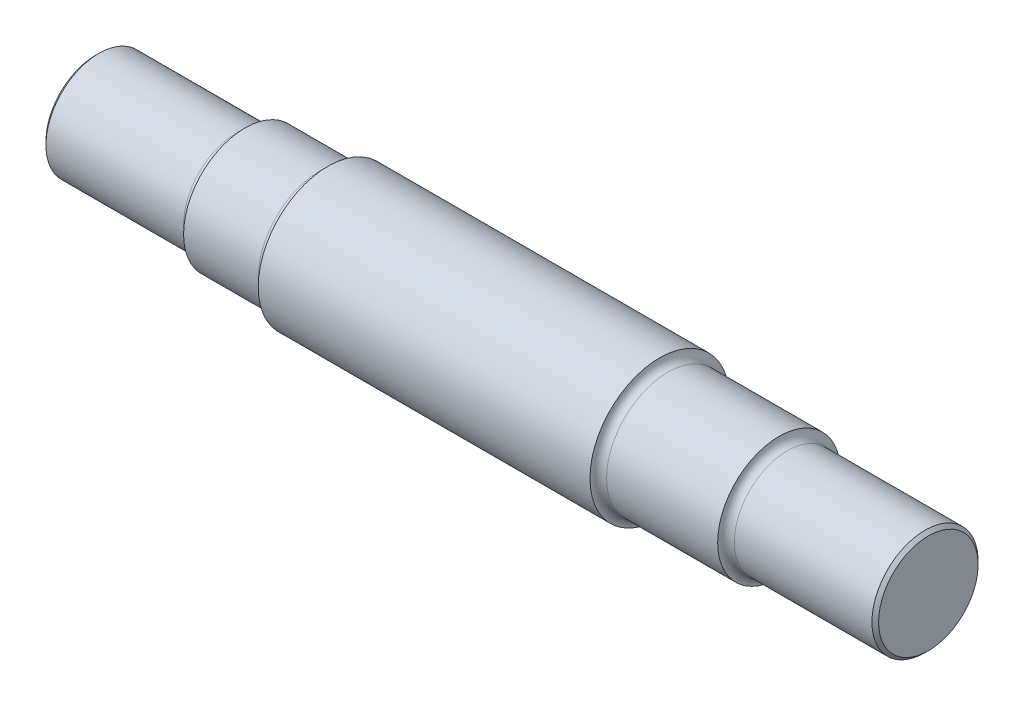
from build123d import *

# Parameters (mm, degrees)
FILLET1_R     = 2.5
CHAMFER1_SIZE = 1


with BuildPart() as part:
    # Sketch1 → Revolve1 (revolve)
    with BuildSketch(Plane.XY, mode=Mode.PRIVATE) as revolve1_sk:
        Polygon((0, 0), (251, 0), (251, 16), (206, 16), (206, 18.5), (170, 18.5), (170, 21), (70, 21), (70, 18.5), (45, 18.5), (45, 16), (0, 16), align=None)
    revolve(revolve1_sk.sketch.rotate(Axis((0, 0, 0), (1, 0, 0)), 90), axis=Axis((0, 0, 0), (1, 0, 0)))

    # Fillet1
    fillet1_edges = [part.edges().sort_by_distance(p)[0] for p in [
        (170, 0, -18.5),
        (70, 0, -18.5),
        (45, 0, -16),
        (206, 0, -16),
    ]]
    fillet(fillet1_edges, radius=FILLET1_R - 0.0001)  # a hair under: the kernel refuses the full size

    # Chamfer1
    chamfer1_edges = [part.edges().sort_by_distance(p)[0] for p in [
        (0, 0, -16),
        (251, 0, -16),
    ]]
    chamfer(chamfer1_edges, length=CHAMFER1_SIZE)


solid = part.part
